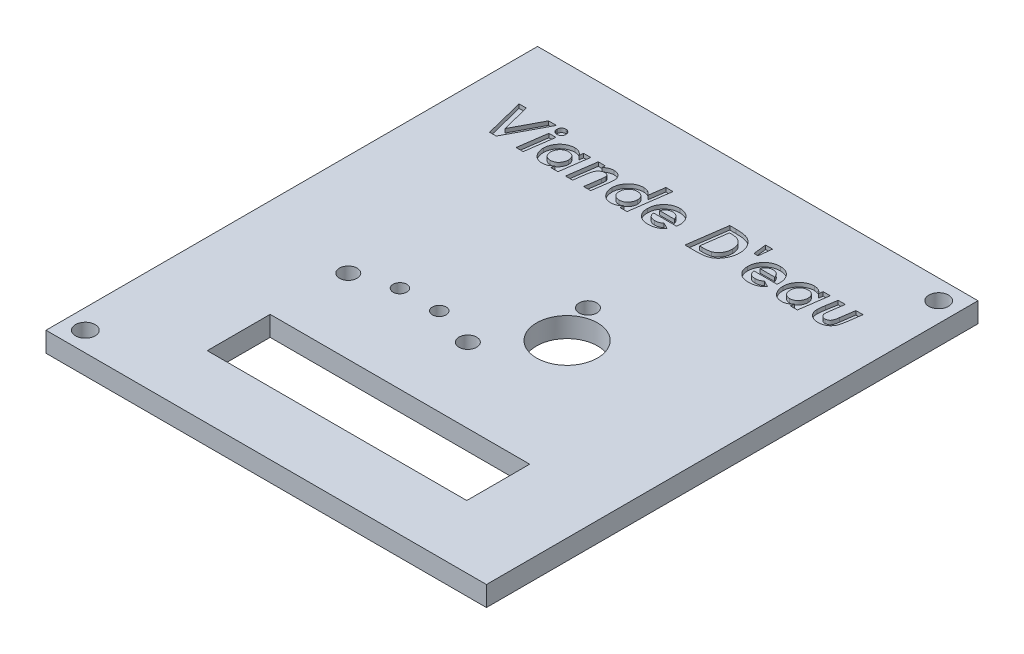
from build123d import *

# Parameters (mm, degrees)
SKETCH1_W           = 112
SKETCH1_H           = 125
BOSS_EXTRUDE1_DEPTH = 5.08
CUT_EXTRUDE1_REACH  = 86.072
SKETCH5_W           = 66
SKETCH5_H           = 16
SKETCH5_R           = 7.75
SKETCH5_R_2         = 2.25
SKETCH5_R_3         = 1.75
SKETCH7_R           = 2.5
CUT_EXTRUDE3_DEPTH  = 4
CUT_EXTRUDE4_DEPTH  = 1


with BuildPart() as part:
    # Sketch1 → Boss-Extrude1 (new body)
    with BuildSketch(Plane(origin=(0, 0, 0), x_dir=(1, 0, 0), z_dir=(0, 1, 0))):
        Rectangle(SKETCH1_W, SKETCH1_H)
    extrude(amount=BOSS_EXTRUDE1_DEPTH)

    # Sketch5 → Cut-Extrude1 (cut, up to next)
    with BuildSketch(Plane(origin=(0, 5.08, 0), x_dir=(1, 0, 0), z_dir=(0, 1, 0)), mode=Mode.PRIVATE) as cut_extrude1_sk1:
        with Locations((2, -38.5)):
            Rectangle(SKETCH5_W, SKETCH5_H)
    cut_extrude1_tool1 = extrude(cut_extrude1_sk1.sketch, amount=-CUT_EXTRUDE1_REACH, mode=Mode.PRIVATE) & part.part
    # Sketch5 → Cut-Extrude1 (cut, up to next)
    with BuildSketch(Plane(origin=(0, 5.08, 0), x_dir=(1, 0, 0), z_dir=(0, 1, 0)), mode=Mode.PRIVATE) as cut_extrude1_sk2:
        with Locations((12.5, 1.5)):
            Circle(SKETCH5_R)
    cut_extrude1_tool2 = extrude(cut_extrude1_sk2.sketch, amount=-CUT_EXTRUDE1_REACH, mode=Mode.PRIVATE) & part.part
    # Sketch5 → Cut-Extrude1 (cut, up to next)
    with BuildSketch(Plane(origin=(0, 5.08, 0), x_dir=(1, 0, 0), z_dir=(0, 1, 0)), mode=Mode.PRIVATE) as cut_extrude1_sk3:
        with Locations((-30.13, -11.51)):
            Circle(SKETCH5_R_2)
    cut_extrude1_tool3 = extrude(cut_extrude1_sk3.sketch, amount=-CUT_EXTRUDE1_REACH, mode=Mode.PRIVATE) & part.part
    # Sketch5 → Cut-Extrude1 (cut, up to next)
    with BuildSketch(Plane(origin=(0, 5.08, 0), x_dir=(1, 0, 0), z_dir=(0, 1, 0)), mode=Mode.PRIVATE) as cut_extrude1_sk4:
        with Locations((-20.25, -8.2495)):
            Circle(SKETCH5_R_3)
    cut_extrude1_tool4 = extrude(cut_extrude1_sk4.sketch, amount=-CUT_EXTRUDE1_REACH, mode=Mode.PRIVATE) & part.part
    # Sketch5 → Cut-Extrude1 (cut, up to next)
    with BuildSketch(Plane(origin=(0, 5.08, 0), x_dir=(1, 0, 0), z_dir=(0, 1, 0)), mode=Mode.PRIVATE) as cut_extrude1_sk5:
        with Locations((-10.25, -8.2495)):
            Circle(SKETCH5_R_3)
    cut_extrude1_tool5 = extrude(cut_extrude1_sk5.sketch, amount=-CUT_EXTRUDE1_REACH, mode=Mode.PRIVATE) & part.part
    # Sketch5 → Cut-Extrude1 (cut, up to next)
    with BuildSketch(Plane(origin=(0, 5.08, 0), x_dir=(1, 0, 0), z_dir=(0, 1, 0)), mode=Mode.PRIVATE) as cut_extrude1_sk6:
        with Locations((0.2695, -11.51)):
            Circle(SKETCH5_R_2)
    cut_extrude1_tool6 = extrude(cut_extrude1_sk6.sketch, amount=-CUT_EXTRUDE1_REACH, mode=Mode.PRIVATE) & part.part
    # Sketch5 → Cut-Extrude1 (cut, up to next)
    with BuildSketch(Plane(origin=(0, 5.08, 0), x_dir=(1, 0, 0), z_dir=(0, 1, 0)), mode=Mode.PRIVATE) as cut_extrude1_sk7:
        with Locations((8.001, 11.311)):
            Circle(SKETCH5_R_2)
    cut_extrude1_tool7 = extrude(cut_extrude1_sk7.sketch, amount=-CUT_EXTRUDE1_REACH, mode=Mode.PRIVATE) & part.part
    add(cut_extrude1_tool1.solids().sort_by_distance((2, 5.08, 38.5))[0], mode=Mode.SUBTRACT)
    add(cut_extrude1_tool2.solids().sort_by_distance((12.5, 5.08, -1.5))[0], mode=Mode.SUBTRACT)
    add(cut_extrude1_tool3.solids().sort_by_distance((-30.13, 5.08, 11.51))[0], mode=Mode.SUBTRACT)
    add(cut_extrude1_tool4.solids().sort_by_distance((-20.25, 5.08, 8.2495))[0], mode=Mode.SUBTRACT)
    add(cut_extrude1_tool5.solids().sort_by_distance((-10.25, 5.08, 8.2495))[0], mode=Mode.SUBTRACT)
    add(cut_extrude1_tool6.solids().sort_by_distance((0.2695, 5.08, 11.51))[0], mode=Mode.SUBTRACT)
    add(cut_extrude1_tool7.solids().sort_by_distance((8.001, 5.08, -11.311))[0], mode=Mode.SUBTRACT)

    # Sketch7 → Cut-Extrude3 (cut)
    with BuildSketch(Plane(origin=(0, 5.08, 0), x_dir=(1, 0, 0), z_dir=(0, 1, 0))):
        with Locations((-51, -57.5)):
            Circle(SKETCH7_R)
        with Locations((51, 57.5)):
            Circle(SKETCH7_R)
    extrude(amount=-CUT_EXTRUDE3_DEPTH, mode=Mode.SUBTRACT)

    # Sketch8 → Cut-Extrude4 (cut)
    # profile 1 of 12: a face of its own
    with BuildSketch(Plane(origin=(0, 5.08, 0), x_dir=(1, 0, 0), z_dir=(0, 1, 0))):
        Polygon((-45.701121795, 47.5), (-43.854166667, 47.5), (-42.051282051, 40.280448718), (-38.219150641, 47.5), (-36.203926282, 47.5), (-41.514423077, 37.5), (-43.203125, 37.5), align=None)
    # profile 2 of 12: a face of its own
    with BuildSketch(Plane(origin=(0, 5.08, 0), x_dir=(1, 0, 0), z_dir=(0, 1, 0))):
        with BuildLine():
            add(Edge.make_bspline(
                [(-34.166666667, 47.884615385), (-34.090168141, 47.880154588), (-33.939902581, 47.871392274), (-33.721996686, 47.808443635), (-33.525282026, 47.695851355), (-33.348226491, 47.549209407), (-33.201584542, 47.372153871), (-33.088992262, 47.175439211), (-33.026043624, 46.957533316), (-33.017281309, 46.807267757), (-33.012820513, 46.730769231)],
                knots=[0, 0, 0, 0, 1.014134371, 1.992057583, 2.975098753, 4, 5.024901247, 6.007942417, 6.985865629, 8, 8, 8, 8], degree=3))
            add(Edge.make_bspline(
                [(-33.012820513, 46.730769231), (-33.017250894, 46.65425342), (-33.025953463, 46.503953908), (-33.089503717, 46.285729419), (-33.200892841, 46.087630522), (-33.348398016, 45.910535017), (-33.524676948, 45.76327428), (-33.722610507, 45.653540087), (-33.939824205, 45.5900065), (-34.090141701, 45.58133675), (-34.166666667, 45.576923077)],
                knots=[0, 0, 0, 0, 1.013694729, 1.991193998, 2.981551723, 4.006008661, 5.030465598, 6.008806002, 6.986305271, 8, 8, 8, 8], degree=3))
            add(Edge.make_bspline(
                [(-34.166666667, 45.576923077), (-34.243208518, 45.581306562), (-34.39355918, 45.589917014), (-34.611099043, 45.654050805), (-34.810403902, 45.762583185), (-34.986731658, 45.910704239), (-35.134852712, 46.087031995), (-35.243385093, 46.286336855), (-35.307518884, 46.503876717), (-35.316129335, 46.65422738), (-35.320512821, 46.730769231)],
                knots=[0, 0, 0, 0, 1.01324697, 1.990314468, 2.975995575, 4, 5.024004425, 6.009685532, 6.98675303, 8, 8, 8, 8], degree=3))
            add(Edge.make_bspline(
                [(-35.320512821, 46.730769231), (-35.316099147, 46.807294197), (-35.307429397, 46.957611693), (-35.24389581, 47.174825391), (-35.134161618, 47.372758949), (-34.98690088, 47.549037882), (-34.809805376, 47.696543056), (-34.611706479, 47.80793218), (-34.39348199, 47.871482435), (-34.243182478, 47.880185004), (-34.166666667, 47.884615385)],
                knots=[0, 0, 0, 0, 1.013694729, 1.991193998, 2.969534402, 3.993991339, 5.018448277, 6.008806002, 6.986305271, 8, 8, 8, 8], degree=3))
        make_face()
    # profile 3 of 12: a face of its own
    with BuildSketch(Plane(origin=(0, 5.08, 0), x_dir=(1, 0, 0), z_dir=(0, 1, 0))):
        Polygon((-35.436698718, 44.807692308), (-33.625801282, 44.807692308), (-34.663461538, 37.5), (-36.474358974, 37.5), align=None)
    # profile 4 of 12: a face of its own
    with BuildSketch(Plane(origin=(0, 5.08, 0), x_dir=(1, 0, 0), z_dir=(0, 1, 0))):
        with BuildLine():
            Line((-26.590544872, 44.807692308), (-24.779647436, 44.807692308))
            Line((-24.779647436, 44.807692308), (-25.817307692, 37.5))
            Line((-25.817307692, 37.5), (-27.628205128, 37.5))
            Line((-27.628205128, 37.5), (-27.502003205, 38.393429487))
            add(Edge.make_bspline(
                [(-27.502003205, 38.393429487), (-27.596165009, 38.30380025), (-27.775714867, 38.132893192), (-28.0538057, 37.911169477), (-28.321500692, 37.730846121), (-28.585417776, 37.592540437), (-28.852806016, 37.49219743), (-29.130355838, 37.422696681), (-29.423710854, 37.379229714), (-29.624576983, 37.374314815), (-29.727564103, 37.371794872)],
                knots=[0, 0, 0, 0, 1.236324186, 2.357450916, 3.379388742, 4.30284698, 5.185433758, 6.089881904, 7.020653398, 8, 8, 8, 8], degree=3))
            add(Edge.make_bspline(
                [(-29.727564103, 37.371794872), (-29.845280738, 37.374537242), (-30.075822558, 37.37990803), (-30.41211944, 37.431881511), (-30.730039852, 37.513166924), (-31.029733509, 37.627863127), (-31.309581065, 37.777574259), (-31.572261767, 37.959060008), (-31.815400222, 38.174554488), (-32.035661884, 38.421207259), (-32.234304226, 38.68705184), (-32.407083008, 38.967971852), (-32.557110056, 39.257394635), (-32.673882925, 39.560607634), (-32.770277785, 39.871940162), (-32.834808102, 40.195544472), (-32.876434841, 40.529097145), (-32.881867435, 40.755081928), (-32.884615385, 40.869391026)],
                knots=[0, 0, 0, 0, 1.072254913, 2.099954687, 3.093402483, 4.05863531, 5.017013142, 5.979305845, 6.962352722, 7.970695896, 8.988290287, 9.983079422, 10.973839091, 11.95483031, 12.940586347, 13.940815436, 14.958409826, 16, 16, 16, 16], degree=3))
            add(Edge.make_bspline(
                [(-32.884615385, 40.869391026), (-32.883236568, 40.9575963), (-32.88049368, 41.133063612), (-32.853403031, 41.39479328), (-32.809262173, 41.652958862), (-32.748638316, 41.908417049), (-32.673071409, 42.161097798), (-32.578607589, 42.410092993), (-32.465295672, 42.654901272), (-32.337927797, 42.895815676), (-32.197340778, 43.129930558), (-32.039633622, 43.349667728), (-31.874083821, 43.559043029), (-31.69538113, 43.75395118), (-31.503975925, 43.933755895), (-31.303813837, 44.104126994), (-31.088449555, 44.256810443), (-30.865466716, 44.39978071), (-30.633570088, 44.524268592), (-30.399044252, 44.636138778), (-30.160077674, 44.727336176), (-29.919683931, 44.804535342), (-29.675767518, 44.862508288), (-29.42951941, 44.904179452), (-29.180650166, 44.931834347), (-29.013827951, 44.934541684), (-28.930288462, 44.935897436)],
                knots=[0, 0, 0, 0, 1.010861959, 2.01091412, 3.012605424, 4.011485121, 5.018863341, 6.033918867, 7.061452407, 8.109228878, 9.15680961, 10.18900835, 11.207521355, 12.215190347, 13.216881651, 14.216552911, 15.225616441, 16.240671966, 17.251099115, 18.240697123, 19.217272556, 20.180771028, 21.133199006, 22.08832996, 23.042693801, 24, 24, 24, 24], degree=3))
            add(Edge.make_bspline(
                [(-28.930288462, 44.935897436), (-28.819191581, 44.932732258), (-28.600203685, 44.926493238), (-28.279463882, 44.86800718), (-27.972201152, 44.775504956), (-27.679176072, 44.647228185), (-27.403989777, 44.4837752), (-27.154678182, 44.282434949), (-26.925608021, 44.051652657), (-26.800396424, 43.872881454), (-26.736778846, 43.782051282)],
                knots=[0, 0, 0, 0, 1.030509072, 2.031281277, 3.015697838, 4.003854478, 4.993584726, 5.977161716, 6.972235198, 8, 8, 8, 8], degree=3))
            Line((-26.736778846, 43.782051282), (-26.590544872, 44.807692308))
        make_face()
        with BuildLine():
            add(Edge.make_bspline(
                [(-29.324919872, 39.038461538), (-29.220494939, 39.041689162), (-29.016846835, 39.047983632), (-28.722629865, 39.103742438), (-28.448460591, 39.191548199), (-28.194753294, 39.317066724), (-27.960635481, 39.482149636), (-27.748124673, 39.68818553), (-27.556182532, 39.935002168), (-27.387852535, 40.215163443), (-27.247174137, 40.516474437), (-27.144101346, 40.827544421), (-27.078369053, 41.14240276), (-27.070989122, 41.354522178), (-27.067307692, 41.460336538)],
                knots=[0, 0, 0, 0, 1.017901168, 1.985097214, 2.910041334, 3.818973104, 4.735274743, 5.693545178, 6.695670165, 7.777101795, 8.875856117, 9.932619244, 10.968700869, 12, 12, 12, 12], degree=3))
            add(Edge.make_bspline(
                [(-27.067307692, 41.460336538), (-27.068991792, 41.526496479), (-27.072301419, 41.6565153), (-27.093935568, 41.846380913), (-27.131967002, 42.026240081), (-27.186535549, 42.19598169), (-27.256238672, 42.355788287), (-27.341592957, 42.506128365), (-27.44137962, 42.64594925), (-27.556076659, 42.775131514), (-27.684250922, 42.889581627), (-27.820151248, 42.994506579), (-27.970095537, 43.076898754), (-28.126815553, 43.148795928), (-28.294593943, 43.20182968), (-28.471147359, 43.243151159), (-28.658681953, 43.264153913), (-28.786683047, 43.267512596), (-28.852163462, 43.269230769)],
                knots=[0, 0, 0, 0, 1.109141645, 2.179707075, 3.198451464, 4.18615572, 5.163657463, 6.116161664, 7.079133258, 8.038519567, 9.005387219, 9.956904198, 10.909408399, 11.866440704, 12.843493655, 13.853714903, 14.902043453, 16, 16, 16, 16], degree=3))
            add(Edge.make_bspline(
                [(-28.852163462, 43.269230769), (-28.928415464, 43.267566333), (-29.078946805, 43.264280521), (-29.300150806, 43.230344404), (-29.513502676, 43.179673616), (-29.716936735, 43.103847069), (-29.912575584, 43.01038925), (-30.097377173, 42.892311546), (-30.274934462, 42.755491926), (-30.441477668, 42.598631444), (-30.593385826, 42.425069972), (-30.726337921, 42.237833532), (-30.839478702, 42.037989804), (-30.931669512, 41.825851283), (-31.001469235, 41.600508852), (-31.053989185, 41.364874349), (-31.084238345, 41.115904953), (-31.08787896, 40.946261872), (-31.08974359, 40.859375)],
                knots=[0, 0, 0, 0, 0.994897251, 1.964056203, 2.915642991, 3.853470011, 4.79324038, 5.741466074, 6.711095529, 7.716481674, 8.723680824, 9.71796663, 10.70964959, 11.717112863, 12.731868792, 13.785363818, 14.865719672, 16, 16, 16, 16], degree=3))
            add(Edge.make_bspline(
                [(-31.08974359, 40.859375), (-31.088029432, 40.792557497), (-31.084677254, 40.66189032), (-31.063597899, 40.470412262), (-31.022547959, 40.28973594), (-30.968644325, 40.118684656), (-30.90064345, 39.957093689), (-30.815946531, 39.805950891), (-30.715108919, 39.66497405), (-30.599582859, 39.535309025), (-30.470940934, 39.419876798), (-30.334614958, 39.316156782), (-30.187679412, 39.230280662), (-30.032139981, 39.159268084), (-29.867427054, 39.105306177), (-29.694124489, 39.068073327), (-29.512632706, 39.042607541), (-29.388445688, 39.039864629), (-29.324919872, 39.038461538)],
                knots=[0, 0, 0, 0, 1.124431694, 2.198919568, 3.234766021, 4.236791382, 5.213425507, 6.179206721, 7.145706547, 8.12447102, 9.094881178, 10.04988442, 11.001776355, 11.952075609, 12.922030374, 13.911569148, 14.931697721, 16, 16, 16, 16], degree=3))
        make_face(mode=Mode.SUBTRACT)
    # profile 5 of 12: a face of its own
    with BuildSketch(Plane(origin=(0, 5.08, 0), x_dir=(1, 0, 0), z_dir=(0, 1, 0))):
        with BuildLine():
            Line((-22.872596154, 44.807692308), (-21.061698718, 44.807692308))
            Line((-21.061698718, 44.807692308), (-21.17588141, 44.000400641))
            add(Edge.make_bspline(
                [(-21.17588141, 44.000400641), (-21.088807224, 44.074537439), (-20.918597248, 44.2194578), (-20.650791447, 44.409409918), (-20.382763712, 44.574477176), (-20.109020923, 44.703596167), (-19.834186255, 44.808230119), (-19.556322565, 44.881747101), (-19.275080076, 44.928365647), (-19.086717333, 44.933384208), (-18.992387821, 44.935897436)],
                knots=[0, 0, 0, 0, 1.129074261, 2.207080079, 3.239806547, 4.233987332, 5.191979582, 6.140686111, 7.068880775, 8, 8, 8, 8], degree=3))
            add(Edge.make_bspline(
                [(-18.992387821, 44.935897436), (-18.913539959, 44.933655668), (-18.758755356, 44.929254901), (-18.531843723, 44.904109201), (-18.316782141, 44.857417271), (-18.112219218, 44.79382962), (-17.920126055, 44.708116834), (-17.73590606, 44.60909327), (-17.565389279, 44.486875693), (-17.405660736, 44.350170529), (-17.262808211, 44.197957198), (-17.134731094, 44.037721439), (-17.02844261, 43.865715005), (-16.93934591, 43.684985249), (-16.871075476, 43.493375881), (-16.82328867, 43.292537314), (-16.794834635, 43.082411344), (-16.790878727, 42.939457897), (-16.788862179, 42.866586538)],
                knots=[0, 0, 0, 0, 1.118022855, 2.194767494, 3.230795032, 4.233728951, 5.225657328, 6.208555818, 7.193457995, 8.193528683, 9.184553253, 10.148487881, 11.096723343, 12.045053303, 13.000209424, 13.973718189, 14.967090947, 16, 16, 16, 16], degree=3))
            add(Edge.make_bspline(
                [(-16.788862179, 42.866586538), (-16.791023067, 42.787773613), (-16.795807547, 42.613271821), (-16.816132661, 42.32507586), (-16.856384753, 41.986184279), (-16.888092814, 41.742751195), (-16.905048077, 41.612580128)],
                knots=[0, 0, 0, 0, 0.750743129, 1.6622403, 2.749928862, 4, 4, 4, 4], degree=3))
            Line((-16.905048077, 41.612580128), (-17.483974359, 37.5))
            Line((-17.483974359, 37.5), (-19.294871795, 37.5))
            Line((-19.294871795, 37.5), (-18.727964744, 41.522435897))
            add(Edge.make_bspline(
                [(-18.727964744, 41.522435897), (-18.715599095, 41.613869479), (-18.692520649, 41.7845152), (-18.665498261, 42.022163247), (-18.651220057, 42.223393291), (-18.647505357, 42.345071267), (-18.645833333, 42.399839744)],
                knots=[0, 0, 0, 0, 1.255630561, 2.343427635, 3.254360171, 4, 4, 4, 4], degree=3))
            add(Edge.make_bspline(
                [(-18.645833333, 42.399839744), (-18.648682752, 42.465566045), (-18.654147544, 42.591619997), (-18.701905772, 42.769616513), (-18.786362845, 42.922484556), (-18.903101454, 43.048703807), (-19.049174122, 43.148277804), (-19.222557594, 43.220969183), (-19.424510843, 43.262228843), (-19.567780818, 43.266811211), (-19.643429487, 43.269230769)],
                knots=[0, 0, 0, 0, 1.048265012, 2.010427263, 2.912347805, 3.810226671, 4.72992967, 5.714049657, 6.792984344, 8, 8, 8, 8], degree=3))
            add(Edge.make_bspline(
                [(-19.643429487, 43.269230769), (-19.72116936, 43.264906136), (-19.878586244, 43.256149106), (-20.114749236, 43.198316662), (-20.347523926, 43.096783475), (-20.578182309, 42.964409875), (-20.796679458, 42.797457691), (-20.989260995, 42.594762458), (-21.15744301, 42.364437207), (-21.273846502, 42.145952565), (-21.354939254, 41.945786584), (-21.415068056, 41.763781865), (-21.471628933, 41.5513111), (-21.529925588, 41.309687721), (-21.585360257, 41.037538905), (-21.641325037, 40.736436802), (-21.695646915, 40.404525028), (-21.727928593, 40.173016903), (-21.744791667, 40.052083333)],
                knots=[0, 0, 0, 0, 0.882065441, 1.786110384, 2.740104157, 3.754965612, 4.797500545, 5.847687264, 6.91599857, 8.024311006, 8.646136181, 9.364850473, 10.197408591, 11.140054438, 12.184569392, 13.348033438, 14.614684545, 16, 16, 16, 16], degree=3))
            Line((-21.744791667, 40.052083333), (-22.099358974, 37.5))
            Line((-22.099358974, 37.5), (-23.91025641, 37.5))
            Line((-23.91025641, 37.5), (-22.872596154, 44.807692308))
        make_face()
    # profile 6 of 12: a face of its own
    with BuildSketch(Plane(origin=(0, 5.08, 0), x_dir=(1, 0, 0), z_dir=(0, 1, 0))):
        with BuildLine():
            Line((-8.625801282, 47.756410256), (-6.816907051, 47.756410256))
            Line((-6.816907051, 47.756410256), (-8.255208333, 37.5))
            Line((-8.255208333, 37.5), (-10.064102564, 37.5))
            Line((-10.064102564, 37.5), (-9.939903846, 38.377403846))
            add(Edge.make_bspline(
                [(-9.939903846, 38.377403846), (-10.037041394, 38.290089598), (-10.222695667, 38.123210119), (-10.50497816, 37.90236628), (-10.780098531, 37.726603976), (-11.049938862, 37.590837104), (-11.322513271, 37.489506877), (-11.607353203, 37.423181768), (-11.907018949, 37.379184032), (-12.112549946, 37.374293343), (-12.217548077, 37.371794872)],
                knots=[0, 0, 0, 0, 1.224191978, 2.339738612, 3.35557837, 4.279346016, 5.166550601, 6.074424882, 7.016295399, 8, 8, 8, 8], degree=3))
            add(Edge.make_bspline(
                [(-12.217548077, 37.371794872), (-12.337926604, 37.374558334), (-12.573766458, 37.379972376), (-12.917451609, 37.431598333), (-13.242495081, 37.513526622), (-13.549564589, 37.627800214), (-13.837009965, 37.777032118), (-14.106069791, 37.958276479), (-14.353226013, 38.175167353), (-14.579978549, 38.420233658), (-14.781655165, 38.687777871), (-14.96193294, 38.966604908), (-15.112361038, 39.257957418), (-15.234617037, 39.559998325), (-15.332032524, 39.871947805), (-15.399508122, 40.195282115), (-15.440378546, 40.529130036), (-15.445916636, 40.755092976), (-15.448717949, 40.869391026)],
                knots=[0, 0, 0, 0, 1.084756537, 2.125203127, 3.125436952, 4.102778343, 5.072150728, 6.038977154, 7.020481913, 8.030147435, 9.044022342, 10.037711967, 11.020545278, 11.995435886, 12.972332138, 13.96300789, 14.969635358, 16, 16, 16, 16], degree=3))
            add(Edge.make_bspline(
                [(-15.448717949, 40.869391026), (-15.447350493, 40.957598719), (-15.444630204, 41.133070845), (-15.417371358, 41.394764688), (-15.373842717, 41.653220059), (-15.310731295, 41.908507581), (-15.232610002, 42.160688995), (-15.139256257, 42.410642036), (-15.02299301, 42.654752896), (-14.894556953, 42.896626545), (-14.748691037, 43.128623473), (-14.592167426, 43.351039683), (-14.421930623, 43.559044207), (-14.239452488, 43.753358859), (-14.045943252, 43.934481187), (-13.841698359, 44.104072302), (-13.622483225, 44.2568845), (-13.39541477, 44.399738002), (-13.159168558, 44.52486899), (-12.919463385, 44.635669785), (-12.676104031, 44.727432252), (-12.431658051, 44.804532364), (-12.183757028, 44.862516159), (-11.93350818, 44.904181055), (-11.679975707, 44.931907311), (-11.509821436, 44.934562552), (-11.424278846, 44.935897436)],
                knots=[0, 0, 0, 0, 1.001967791, 1.993220895, 2.986098719, 3.977961405, 4.97869321, 5.984817669, 7.006498751, 8.048625242, 9.094941425, 10.118058263, 11.137144237, 12.14626801, 13.144667405, 14.147209555, 15.159750235, 16.178723228, 17.193620539, 18.195157345, 19.177309233, 20.146807454, 21.105618391, 22.067306845, 23.028366579, 24, 24, 24, 24], degree=3))
            add(Edge.make_bspline(
                [(-11.424278846, 44.935897436), (-11.311168059, 44.932044965), (-11.088100298, 44.92444744), (-10.761190764, 44.864178897), (-10.447679683, 44.768492535), (-10.150873625, 44.630829284), (-9.871150316, 44.458896128), (-9.615240864, 44.249336822), (-9.385690388, 44.002234352), (-9.257832654, 43.815211824), (-9.192708333, 43.719951923)],
                knots=[0, 0, 0, 0, 1.021752344, 2.015015653, 2.994318812, 3.977315891, 4.96380846, 5.954501398, 6.958125541, 8, 8, 8, 8], degree=3))
            Line((-9.192708333, 43.719951923), (-8.625801282, 47.756410256))
        make_face()
        with BuildLine():
            add(Edge.make_bspline(
                [(-11.834935897, 39.038461538), (-11.727846275, 39.041692581), (-11.518907673, 39.047996548), (-11.216759182, 39.103767765), (-10.934630911, 39.191476689), (-10.673054623, 39.316984869), (-10.430958636, 39.481240673), (-10.212286924, 39.68798175), (-10.014023669, 39.934587293), (-9.840180915, 40.215014305), (-9.692400078, 40.515430222), (-9.588443256, 40.827551692), (-9.519708216, 41.142153745), (-9.512705717, 41.354483346), (-9.509214744, 41.460336538)],
                knots=[0, 0, 0, 0, 1.029364739, 2.008355467, 2.944869541, 3.864220442, 4.788874237, 5.747766117, 6.747937481, 7.824404024, 8.916094465, 9.960164733, 10.983075963, 12, 12, 12, 12], degree=3))
            add(Edge.make_bspline(
                [(-9.509214744, 41.460336538), (-9.510732019, 41.526509124), (-9.513715639, 41.656633057), (-9.537745146, 41.846541308), (-9.578484548, 42.025914346), (-9.631884173, 42.196496723), (-9.704442823, 42.355757063), (-9.791354938, 42.506813392), (-9.89553013, 42.646009091), (-10.014098212, 42.775245054), (-10.146266677, 42.889663643), (-10.28621809, 42.994593339), (-10.440132016, 43.076888973), (-10.601386935, 43.149218754), (-10.774657657, 43.201769854), (-10.956532728, 43.242956441), (-11.149336001, 43.264258188), (-11.280671708, 43.267542938), (-11.348157051, 43.269230769)],
                knots=[0, 0, 0, 0, 1.092929283, 2.14917182, 3.155385987, 4.128652935, 5.096340581, 6.040415546, 7.002301806, 7.962478832, 8.931674171, 9.887023602, 10.844853392, 11.808066958, 12.802359889, 13.83011003, 14.885026967, 16, 16, 16, 16], degree=3))
            add(Edge.make_bspline(
                [(-11.348157051, 43.269230769), (-11.427078469, 43.267593637), (-11.582262591, 43.264374524), (-11.810113967, 43.230342353), (-12.029431944, 43.179688994), (-12.238863571, 43.103884119), (-12.440505263, 43.010502904), (-12.631229328, 42.892331861), (-12.814860199, 42.756345704), (-12.985334724, 42.597994313), (-13.143384246, 42.425841266), (-13.280393016, 42.238394754), (-13.395688474, 42.038103392), (-13.488988992, 41.825509296), (-13.5648781, 41.601316948), (-13.615079367, 41.364599561), (-13.649137462, 41.11610618), (-13.652251836, 40.946301733), (-13.653846154, 40.859375)],
                knots=[0, 0, 0, 0, 1.015017545, 1.99584108, 2.958882485, 3.907551637, 4.857154596, 5.813732046, 6.790026937, 7.79362874, 8.803576363, 9.793693459, 10.775457832, 11.771969563, 12.777519716, 13.815952619, 14.881936806, 16, 16, 16, 16], degree=3))
            add(Edge.make_bspline(
                [(-13.653846154, 40.859375), (-13.652385986, 40.792523704), (-13.649528753, 40.661710169), (-13.624870534, 40.470626313), (-13.585359893, 40.289324751), (-13.528395359, 40.118725257), (-13.459179712, 39.956347823), (-13.369526644, 39.806544323), (-13.267332764, 39.664186198), (-13.147416212, 39.535302307), (-13.014983369, 39.419744279), (-12.874535338, 39.316160869), (-12.723234158, 39.229681609), (-12.562562334, 39.159733342), (-12.393449505, 39.105239664), (-12.215480446, 39.067895923), (-12.028630803, 39.042643307), (-11.900460787, 39.039876186), (-11.834935897, 39.038461538)],
                knots=[0, 0, 0, 0, 1.107979885, 2.168077127, 3.188767881, 4.179540202, 5.146268969, 6.108932095, 7.067768028, 8.04709314, 9.01982551, 9.978661443, 10.935770145, 11.902498912, 12.87931775, 13.876010336, 14.914143953, 16, 16, 16, 16], degree=3))
        make_face(mode=Mode.SUBTRACT)
    # profile 7 of 12: a face of its own
    with BuildSketch(Plane(origin=(0, 5.08, 0), x_dir=(1, 0, 0), z_dir=(0, 1, 0))):
        with BuildLine():
            Line((-0.977564103, 39.661458333), (0.590945513, 38.856169872))
            add(Edge.make_bspline(
                [(0.590945513, 38.856169872), (0.498284259, 38.745303126), (0.312034678, 38.522460412), (-0.02278649, 38.233641197), (-0.397389088, 37.977623233), (-0.813082133, 37.76112666), (-1.262011527, 37.58576748), (-1.739029186, 37.463711892), (-2.238892319, 37.38371554), (-2.580478905, 37.375816755), (-2.754407051, 37.371794872)],
                knots=[0, 0, 0, 0, 0.914244933, 1.837636877, 2.790537697, 3.784087733, 4.800790172, 5.83726639, 6.89878507, 8, 8, 8, 8], degree=3))
            add(Edge.make_bspline(
                [(-2.754407051, 37.371794872), (-2.890098853, 37.374101173), (-3.154229053, 37.378590491), (-3.539281456, 37.424653598), (-3.903155905, 37.494791739), (-4.24400304, 37.597936229), (-4.564727145, 37.725698771), (-4.861371466, 37.886408014), (-5.135866565, 38.076823883), (-5.388237585, 38.291770269), (-5.61248958, 38.533519257), (-5.810205866, 38.793654748), (-5.975003605, 39.075489471), (-6.112509398, 39.374207028), (-6.215800107, 39.694021775), (-6.292674575, 40.030994305), (-6.336377289, 40.388148264), (-6.342843054, 40.632229725), (-6.346153846, 40.757211538)],
                knots=[0, 0, 0, 0, 1.167516698, 2.272623801, 3.333371772, 4.353538571, 5.333382306, 6.300396664, 7.250661637, 8.204535574, 9.148031545, 10.083792083, 11.011414416, 11.952824574, 12.908912643, 13.898953575, 14.92416002, 16, 16, 16, 16], degree=3))
            add(Edge.make_bspline(
                [(-6.346153846, 40.757211538), (-6.343191024, 40.900992049), (-6.33736392, 41.183771011), (-6.276473484, 41.598140728), (-6.18267746, 41.99610608), (-6.051212263, 42.377442243), (-5.877820356, 42.740444396), (-5.672237217, 43.089320878), (-5.423508761, 43.417817326), (-5.142429221, 43.726772767), (-4.835191472, 44.008224156), (-4.509426038, 44.256999616), (-4.166231431, 44.466730755), (-3.808143829, 44.639271351), (-3.433473582, 44.773270181), (-3.043083159, 44.865840688), (-2.637478087, 44.926992976), (-2.361336658, 44.932904856), (-2.221554487, 44.935897436)],
                knots=[0, 0, 0, 0, 1.05529311, 2.075487762, 3.068699193, 4.055083011, 5.031283693, 6.018666653, 7.023995929, 8.051577733, 9.082465902, 10.079966066, 11.057287041, 12.031169187, 12.994424047, 13.973330935, 14.974104677, 16, 16, 16, 16], degree=3))
            add(Edge.make_bspline(
                [(-2.221554487, 44.935897436), (-2.136725939, 44.934014712), (-1.969510387, 44.930303454), (-1.721738688, 44.911154527), (-1.481975735, 44.8737951), (-1.248511714, 44.827263925), (-1.023276864, 44.762153953), (-0.805037826, 44.683349772), (-0.591541994, 44.594637872), (-0.388074932, 44.486922354), (-0.190959945, 44.370466365), (-0.006541567, 44.23612726), (0.169910088, 44.093002696), (0.335317045, 43.936170907), (0.487137695, 43.764771273), (0.630478325, 43.581993196), (0.761935457, 43.385224477), (0.884160561, 43.178422296), (0.991156932, 42.961351747), (1.088501226, 42.741127244), (1.165571005, 42.513833281), (1.233549537, 42.28386781), (1.281454653, 42.046939481), (1.32189723, 41.80675865), (1.340305669, 41.561449835), (1.344195745, 41.396919989), (1.346153846, 41.314102564)],
                knots=[0, 0, 0, 0, 1.072343926, 2.113823519, 3.137889586, 4.13760148, 5.120645553, 6.097657508, 7.069516392, 8.039614793, 9.005002879, 9.960565349, 10.920144366, 11.87525951, 12.837543921, 13.811635494, 14.808779264, 15.826321551, 16.845367656, 17.865985152, 18.866871901, 19.876579391, 20.894541571, 21.919893521, 22.952961626, 24, 24, 24, 24], degree=3))
            add(Edge.make_bspline(
                [(1.346153846, 41.314102564), (1.345297618, 41.25933122), (1.343520653, 41.145661923), (1.331027644, 40.967815465), (1.308697902, 40.776801863), (1.288480818, 40.644972609), (1.278044872, 40.576923077)],
                knots=[0, 0, 0, 0, 0.886860648, 1.840539587, 2.885298471, 4, 4, 4, 4], degree=3))
            Line((1.278044872, 40.576923077), (-4.551282051, 40.576923077))
            add(Edge.make_bspline(
                [(-4.551282051, 40.576923077), (-4.547456948, 40.519423051), (-4.539995053, 40.407253761), (-4.514804022, 40.243794298), (-4.471968678, 40.090305405), (-4.415462085, 39.945743277), (-4.347265154, 39.808451029), (-4.265352668, 39.679051518), (-4.166188561, 39.561507159), (-4.055432211, 39.45214302), (-3.931977575, 39.354453445), (-3.796363821, 39.270424273), (-3.651001334, 39.196476624), (-3.492293079, 39.140152105), (-3.323813373, 39.093115305), (-3.143922918, 39.062181334), (-2.953231425, 39.041050786), (-2.821911004, 39.039340628), (-2.754407051, 39.038461538)],
                knots=[0, 0, 0, 0, 1.040300458, 2.029386266, 2.980027991, 3.911437883, 4.828060054, 5.744444316, 6.66911896, 7.598419554, 8.551199615, 9.504589747, 10.47513087, 11.489753162, 12.539789264, 13.630032591, 14.781741895, 16, 16, 16, 16], degree=3))
            add(Edge.make_bspline(
                [(-2.754407051, 39.038461538), (-2.672214327, 39.04059688), (-2.50935632, 39.044827881), (-2.268342375, 39.07218517), (-2.034912281, 39.123645166), (-1.808464696, 39.1916054), (-1.588123982, 39.277033367), (-1.37793505, 39.387456161), (-1.171682391, 39.512819577), (-1.042821351, 39.611490057), (-0.977564103, 39.661458333)],
                knots=[0, 0, 0, 0, 1.027214308, 2.035339218, 3.025519259, 4.010199041, 4.987959988, 5.973205312, 6.973599434, 8, 8, 8, 8], degree=3))
        make_face()
        with BuildLine():
            add(Edge.make_bspline(
                [(-0.576923077, 41.858974359), (-0.612543273, 41.969033397), (-0.681130527, 42.180953827), (-0.830742677, 42.468643499), (-1.013373561, 42.714450086), (-1.229247792, 42.916609361), (-1.474231891, 43.074050302), (-1.743657387, 43.187920517), (-2.037712197, 43.258064842), (-2.242524592, 43.265440952), (-2.34775641, 43.269230769)],
                knots=[0, 0, 0, 0, 1.131480038, 2.178682812, 3.159669316, 4.117470342, 5.058967564, 5.99670948, 6.970717055, 8, 8, 8, 8], degree=3))
            add(Edge.make_bspline(
                [(-2.34775641, 43.269230769), (-2.453032715, 43.265533614), (-2.660689391, 43.258241005), (-2.962392693, 43.183936757), (-3.249808151, 43.069481019), (-3.516719256, 42.905749129), (-3.763767521, 42.703850853), (-3.975813035, 42.457211647), (-4.16268784, 42.176543555), (-4.25395719, 41.966806343), (-4.30088141, 41.858974359)],
                knots=[0, 0, 0, 0, 0.983432494, 1.939812791, 2.890131691, 3.868528921, 4.858194814, 5.863362488, 6.901492691, 8, 8, 8, 8], degree=3))
            Line((-4.30088141, 41.858974359), (-0.576923077, 41.858974359))
        make_face(mode=Mode.SUBTRACT)
    # profile 8 of 12: a face of its own
    with BuildSketch(Plane(origin=(0, 5.08, 0), x_dir=(1, 0, 0), z_dir=(0, 1, 0))):
        with BuildLine():
            Line((7.876602564, 47.5), (9.455128205, 47.5))
            add(Edge.make_bspline(
                [(9.455128205, 47.5), (9.634106235, 47.498521799), (9.980214992, 47.495663244), (10.482133416, 47.472093743), (10.947957331, 47.430492785), (11.378539094, 47.372914164), (11.773913708, 47.299454078), (12.134232182, 47.210503172), (12.459853631, 47.105271386), (12.7516854, 46.978832546), (13.020393288, 46.836949968), (13.272209479, 46.675055098), (13.511471105, 46.495169833), (13.739791639, 46.29843238), (13.952542943, 46.080521319), (14.152718994, 45.843733544), (14.341086009, 45.58858236), (14.517008508, 45.317716603), (14.675252399, 45.031326785), (14.813490646, 44.731992587), (14.932176702, 44.422552807), (15.026050674, 44.10130879), (15.100260856, 43.770082033), (15.154207215, 43.427581317), (15.187137931, 43.074235924), (15.190570549, 42.835274193), (15.192307692, 42.714342949)],
                knots=[0, 0, 0, 0, 1.508928034, 2.917973822, 4.235011166, 5.450779055, 6.579221784, 7.623755204, 8.577985451, 9.460610614, 10.301756591, 11.137250569, 11.981705789, 12.823774396, 13.675702816, 14.546470419, 15.435981066, 16.347923198, 17.267651715, 18.192054867, 19.125737078, 20.059147693, 21.011116727, 21.985721956, 22.980635317, 24, 24, 24, 24], degree=3))
            add(Edge.make_bspline(
                [(15.192307692, 42.714342949), (15.189866894, 42.58940158), (15.185015467, 42.34106316), (15.150204371, 41.973056882), (15.093907845, 41.612503198), (15.016309022, 41.259527411), (14.914108756, 40.913988723), (14.786500597, 40.577707715), (14.641201239, 40.247320849), (14.470455719, 39.929622795), (14.286317394, 39.624583734), (14.086954549, 39.339360232), (13.877855628, 39.074260126), (13.653762838, 38.832920294), (13.418980684, 38.611901543), (13.173421984, 38.411208968), (12.91443769, 38.233626464), (12.642319118, 38.07599913), (12.349821524, 37.937825926), (12.032467086, 37.820773345), (11.689280472, 37.720169223), (11.318619071, 37.641630294), (10.922251063, 37.577514726), (10.499046078, 37.531592321), (10.049052283, 37.506452628), (9.740281313, 37.502192868), (9.581330128, 37.5)],
                knots=[0, 0, 0, 0, 1.035326767, 2.057856534, 3.060426681, 4.057975219, 5.050723532, 6.043595218, 7.036960241, 8.039530388, 9.030318104, 9.988216712, 10.921569661, 11.826132526, 12.714780289, 13.59198308, 14.451536877, 15.31430869, 16.195534129, 17.128821459, 18.114698389, 19.15667332, 20.266554844, 21.441073174, 22.682698532, 24, 24, 24, 24], degree=3))
            Line((9.581330128, 37.5), (6.474358974, 37.5))
            Line((6.474358974, 37.5), (7.876602564, 47.5))
        make_face()
        with BuildLine():
            Line((9.453125, 45.833333333), (8.51963141, 39.166666667))
            Line((8.51963141, 39.166666667), (9.166666667, 39.166666667))
            add(Edge.make_bspline(
                [(9.166666667, 39.166666667), (9.286875704, 39.167282348), (9.518009732, 39.16846616), (9.851890139, 39.181718913), (10.160103696, 39.197495911), (10.442490999, 39.226791747), (10.700083863, 39.259390071), (10.931132452, 39.301859828), (11.138294218, 39.347509074), (11.264332893, 39.390612051), (11.32411859, 39.411057692)],
                knots=[0, 0, 0, 0, 1.323091274, 2.54399687, 3.677836413, 4.719289959, 5.668358043, 6.534823038, 7.305002022, 8, 8, 8, 8], degree=3))
            add(Edge.make_bspline(
                [(11.32411859, 39.411057692), (11.400936335, 39.440914151), (11.553541864, 39.500226756), (11.768757796, 39.615601528), (11.977571477, 39.737885101), (12.170851925, 39.881719259), (12.355450447, 40.037854647), (12.523982198, 40.212962018), (12.684629045, 40.400600863), (12.831697403, 40.604385257), (12.966146615, 40.821046614), (13.080643071, 41.052279529), (13.179507951, 41.295011483), (13.258673515, 41.551248409), (13.321399223, 41.818967188), (13.36425235, 42.098962699), (13.39417064, 42.391178842), (13.396334481, 42.590732766), (13.397435897, 42.692307692)],
                knots=[0, 0, 0, 0, 0.952655881, 1.892538673, 2.821337892, 3.750040712, 4.676008024, 5.615700279, 6.558436491, 7.532008524, 8.520486916, 9.505184105, 10.513747313, 11.549809891, 12.604882282, 13.692134403, 14.825273528, 16, 16, 16, 16], degree=3))
            add(Edge.make_bspline(
                [(13.397435897, 42.692307692), (13.396284924, 42.775801395), (13.394035411, 42.938985159), (13.376359503, 43.178587198), (13.343597666, 43.407840624), (13.300718732, 43.626873578), (13.243729203, 43.835494713), (13.175819168, 44.033660422), (13.096705725, 44.222805527), (12.970090539, 44.456113581), (12.789610786, 44.728311281), (12.525967749, 45.016015665), (12.219592957, 45.26179193), (11.934020232, 45.433548645), (11.684798036, 45.551073483), (11.480119986, 45.626327246), (11.260675073, 45.690927045), (11.026083486, 45.741515418), (10.777727505, 45.784979323), (10.513909227, 45.811039448), (10.235329073, 45.830341973), (10.044108292, 45.832318405), (9.945913462, 45.833333333)],
                knots=[0, 0, 0, 0, 0.941373656, 1.839862062, 2.706559874, 3.551131217, 4.354742518, 5.142827075, 5.911946928, 6.663057697, 8.133107042, 9.582556681, 11.0440985, 12.547036792, 13.328439944, 14.147940985, 15.003216405, 15.905576335, 16.852443473, 17.844335315, 18.893032825, 20, 20, 20, 20], degree=3))
            Line((9.945913462, 45.833333333), (9.453125, 45.833333333))
        make_face(mode=Mode.SUBTRACT)
    # profile 9 of 12: a face of its own
    with BuildSketch(Plane(origin=(0, 5.08, 0), x_dir=(1, 0, 0), z_dir=(0, 1, 0))):
        Polygon((18.141025641, 44.423076923), (17.115384615, 44.423076923), (16.730769231, 47.756410256), (18.525641026, 47.756410256), align=None)
    # profile 10 of 12: a face of its own
    with BuildSketch(Plane(origin=(0, 5.08, 0), x_dir=(1, 0, 0), z_dir=(0, 1, 0))):
        with BuildLine():
            Line((24.53525641, 39.661458333), (26.103766026, 38.856169872))
            add(Edge.make_bspline(
                [(26.103766026, 38.856169872), (26.011104772, 38.745303126), (25.82485519, 38.522460412), (25.490034023, 38.233641197), (25.115431425, 37.977623233), (24.69973838, 37.76112666), (24.250808986, 37.58576748), (23.773791326, 37.463711892), (23.273928194, 37.38371554), (22.932341608, 37.375816755), (22.758413462, 37.371794872)],
                knots=[0, 0, 0, 0, 0.914244933, 1.837636877, 2.790537697, 3.784087733, 4.800790172, 5.83726639, 6.89878507, 8, 8, 8, 8], degree=3))
            add(Edge.make_bspline(
                [(22.758413462, 37.371794872), (22.62272166, 37.374101173), (22.35859146, 37.378590491), (21.973539056, 37.424653598), (21.609664607, 37.494791739), (21.268817473, 37.597936229), (20.948093368, 37.725698771), (20.651449047, 37.886408014), (20.376953948, 38.076823883), (20.124582928, 38.291770269), (19.900330933, 38.533519257), (19.702614647, 38.793654748), (19.537816908, 39.075489471), (19.400311114, 39.374207028), (19.297020406, 39.694021775), (19.220145937, 40.030994305), (19.176443224, 40.388148264), (19.169977459, 40.632229725), (19.166666667, 40.757211538)],
                knots=[0, 0, 0, 0, 1.167516698, 2.272623801, 3.333371772, 4.353538571, 5.333382306, 6.300396664, 7.250661637, 8.204535574, 9.148031545, 10.083792083, 11.011414416, 11.952824574, 12.908912643, 13.898953575, 14.92416002, 16, 16, 16, 16], degree=3))
            add(Edge.make_bspline(
                [(19.166666667, 40.757211538), (19.169629489, 40.900992049), (19.175456593, 41.183771011), (19.236347029, 41.598140728), (19.330143053, 41.99610608), (19.46160825, 42.377442243), (19.635000157, 42.740444396), (19.840583295, 43.089320878), (20.089311752, 43.417817326), (20.370391292, 43.726772767), (20.67762904, 44.008224156), (21.003394475, 44.256999616), (21.346589082, 44.466730755), (21.704676684, 44.639271351), (22.079346931, 44.773270181), (22.469737354, 44.865840688), (22.875342426, 44.926992976), (23.151483855, 44.932904856), (23.291266026, 44.935897436)],
                knots=[0, 0, 0, 0, 1.05529311, 2.075487762, 3.068699193, 4.055083011, 5.031283693, 6.018666653, 7.023995929, 8.051577733, 9.082465902, 10.079966066, 11.057287041, 12.031169187, 12.994424047, 13.973330935, 14.974104677, 16, 16, 16, 16], degree=3))
            add(Edge.make_bspline(
                [(23.291266026, 44.935897436), (23.376094574, 44.934014712), (23.543310126, 44.930303454), (23.791081825, 44.911154527), (24.030844778, 44.8737951), (24.264308799, 44.827263925), (24.489543649, 44.762153953), (24.707782687, 44.683349772), (24.921278519, 44.594637872), (25.124745581, 44.486922354), (25.321860568, 44.370466365), (25.506278946, 44.23612726), (25.682730601, 44.093002696), (25.848137558, 43.936170907), (25.999958208, 43.764771273), (26.143298837, 43.581993196), (26.27475597, 43.385224477), (26.396981074, 43.178422296), (26.503977445, 42.961351747), (26.601321738, 42.741127244), (26.678391518, 42.513833281), (26.74637005, 42.28386781), (26.794275165, 42.046939481), (26.834717742, 41.80675865), (26.853126181, 41.561449835), (26.857016258, 41.396919989), (26.858974359, 41.314102564)],
                knots=[0, 0, 0, 0, 1.072343926, 2.113823519, 3.137889586, 4.13760148, 5.120645553, 6.097657508, 7.069516392, 8.039614793, 9.005002879, 9.960565349, 10.920144366, 11.87525951, 12.837543921, 13.811635494, 14.808779264, 15.826321551, 16.845367656, 17.865985152, 18.866871901, 19.876579391, 20.894541571, 21.919893521, 22.952961626, 24, 24, 24, 24], degree=3))
            add(Edge.make_bspline(
                [(26.858974359, 41.314102564), (26.858118131, 41.25933122), (26.856341166, 41.145661923), (26.843848157, 40.967815465), (26.821518414, 40.776801863), (26.801301331, 40.644972609), (26.790865385, 40.576923077)],
                knots=[0, 0, 0, 0, 0.886860648, 1.840539587, 2.885298471, 4, 4, 4, 4], degree=3))
            Line((26.790865385, 40.576923077), (20.961538462, 40.576923077))
            add(Edge.make_bspline(
                [(20.961538462, 40.576923077), (20.965363565, 40.519423051), (20.97282546, 40.407253761), (20.99801649, 40.243794298), (21.040851835, 40.090305405), (21.097358428, 39.945743277), (21.165555359, 39.808451029), (21.247467845, 39.679051518), (21.346631952, 39.561507159), (21.457388302, 39.45214302), (21.580842938, 39.354453445), (21.716456692, 39.270424273), (21.861819179, 39.196476624), (22.020527434, 39.140152105), (22.18900714, 39.093115305), (22.368897594, 39.062181334), (22.559589088, 39.041050786), (22.690909509, 39.039340628), (22.758413462, 39.038461538)],
                knots=[0, 0, 0, 0, 1.040300458, 2.029386266, 2.980027991, 3.911437883, 4.828060054, 5.744444316, 6.66911896, 7.598419554, 8.551199615, 9.504589747, 10.47513087, 11.489753162, 12.539789264, 13.630032591, 14.781741895, 16, 16, 16, 16], degree=3))
            add(Edge.make_bspline(
                [(22.758413462, 39.038461538), (22.840606186, 39.04059688), (23.003464193, 39.044827881), (23.244478138, 39.07218517), (23.477908232, 39.123645166), (23.704355817, 39.1916054), (23.924696531, 39.277033367), (24.134885463, 39.387456161), (24.341138122, 39.512819577), (24.469999162, 39.611490057), (24.53525641, 39.661458333)],
                knots=[0, 0, 0, 0, 1.027214308, 2.035339218, 3.025519259, 4.010199041, 4.987959988, 5.973205312, 6.973599434, 8, 8, 8, 8], degree=3))
        make_face()
        with BuildLine():
            add(Edge.make_bspline(
                [(24.935897436, 41.858974359), (24.90027724, 41.969033397), (24.831689986, 42.180953827), (24.682077836, 42.468643499), (24.499446952, 42.714450086), (24.28357272, 42.916609361), (24.038588622, 43.074050302), (23.769163125, 43.187920517), (23.475108316, 43.258064842), (23.270295921, 43.265440952), (23.165064103, 43.269230769)],
                knots=[0, 0, 0, 0, 1.131480038, 2.178682812, 3.159669316, 4.117470342, 5.058967564, 5.99670948, 6.970717055, 8, 8, 8, 8], degree=3))
            add(Edge.make_bspline(
                [(23.165064103, 43.269230769), (23.059787798, 43.265533614), (22.852131122, 43.258241005), (22.55042782, 43.183936757), (22.263012361, 43.069481019), (21.996101257, 42.905749129), (21.749052992, 42.703850853), (21.537007478, 42.457211647), (21.350132673, 42.176543555), (21.258863323, 41.966806343), (21.211939103, 41.858974359)],
                knots=[0, 0, 0, 0, 0.983432494, 1.939812791, 2.890131691, 3.868528921, 4.858194814, 5.863362488, 6.901492691, 8, 8, 8, 8], degree=3))
            Line((21.211939103, 41.858974359), (24.935897436, 41.858974359))
        make_face(mode=Mode.SUBTRACT)
    # profile 11 of 12: a face of its own
    with BuildSketch(Plane(origin=(0, 5.08, 0), x_dir=(1, 0, 0), z_dir=(0, 1, 0))):
        with BuildLine():
            Line((34.306891026, 44.807692308), (36.117788462, 44.807692308))
            Line((36.117788462, 44.807692308), (35.080128205, 37.5))
            Line((35.080128205, 37.5), (33.269230769, 37.5))
            Line((33.269230769, 37.5), (33.395432692, 38.393429487))
            add(Edge.make_bspline(
                [(33.395432692, 38.393429487), (33.301270888, 38.30380025), (33.12172103, 38.132893192), (32.843630197, 37.911169477), (32.575935205, 37.730846121), (32.312018121, 37.592540437), (32.044629882, 37.49219743), (31.76708006, 37.422696681), (31.473725043, 37.379229714), (31.272858914, 37.374314815), (31.169871795, 37.371794872)],
                knots=[0, 0, 0, 0, 1.236324186, 2.357450916, 3.379388742, 4.30284698, 5.185433758, 6.089881904, 7.020653398, 8, 8, 8, 8], degree=3))
            add(Edge.make_bspline(
                [(31.169871795, 37.371794872), (31.05215516, 37.374537242), (30.821613339, 37.37990803), (30.485316458, 37.431881511), (30.167396045, 37.513166924), (29.867702388, 37.627863127), (29.587854833, 37.777574259), (29.32517413, 37.959060008), (29.082035675, 38.174554488), (28.861774014, 38.421207259), (28.663131672, 38.68705184), (28.49035289, 38.967971852), (28.340325842, 39.257394635), (28.223552972, 39.560607634), (28.127158112, 39.871940162), (28.062627796, 40.195544472), (28.021001056, 40.529097145), (28.015568463, 40.755081928), (28.012820513, 40.869391026)],
                knots=[0, 0, 0, 0, 1.072254913, 2.099954687, 3.093402483, 4.05863531, 5.017013142, 5.979305845, 6.962352722, 7.970695896, 8.988290287, 9.983079422, 10.973839091, 11.95483031, 12.940586347, 13.940815436, 14.958409826, 16, 16, 16, 16], degree=3))
            add(Edge.make_bspline(
                [(28.012820513, 40.869391026), (28.014199329, 40.9575963), (28.016942217, 41.133063612), (28.044032866, 41.39479328), (28.088173725, 41.652958862), (28.148797582, 41.908417049), (28.224364488, 42.161097798), (28.318828308, 42.410092993), (28.432140225, 42.654901272), (28.5595081, 42.895815676), (28.700095119, 43.129930558), (28.857802276, 43.349667728), (29.023352076, 43.559043029), (29.202054768, 43.75395118), (29.393459973, 43.933755895), (29.593622061, 44.104126994), (29.808986342, 44.256810443), (30.031969182, 44.39978071), (30.263865809, 44.524268592), (30.498391645, 44.636138778), (30.737358224, 44.727336176), (30.977751967, 44.804535342), (31.221668379, 44.862508288), (31.467916487, 44.904179452), (31.716785732, 44.931834347), (31.883607946, 44.934541684), (31.967147436, 44.935897436)],
                knots=[0, 0, 0, 0, 1.010861959, 2.01091412, 3.012605424, 4.011485121, 5.018863341, 6.033918867, 7.061452407, 8.109228878, 9.15680961, 10.18900835, 11.207521355, 12.215190347, 13.216881651, 14.216552911, 15.225616441, 16.240671966, 17.251099115, 18.240697123, 19.217272556, 20.180771028, 21.133199006, 22.08832996, 23.042693801, 24, 24, 24, 24], degree=3))
            add(Edge.make_bspline(
                [(31.967147436, 44.935897436), (32.078244317, 44.932732258), (32.297232213, 44.926493238), (32.617972016, 44.86800718), (32.925234745, 44.775504956), (33.218259825, 44.647228185), (33.493446121, 44.4837752), (33.742757716, 44.282434949), (33.971827876, 44.051652657), (34.097039473, 43.872881454), (34.160657051, 43.782051282)],
                knots=[0, 0, 0, 0, 1.030509072, 2.031281277, 3.015697838, 4.003854478, 4.993584726, 5.977161716, 6.972235198, 8, 8, 8, 8], degree=3))
            Line((34.160657051, 43.782051282), (34.306891026, 44.807692308))
        make_face()
        with BuildLine():
            add(Edge.make_bspline(
                [(31.572516026, 39.038461538), (31.676940958, 39.041689162), (31.880589062, 39.047983632), (32.174806032, 39.103742438), (32.448975306, 39.191548199), (32.702682604, 39.317066724), (32.936800416, 39.482149636), (33.149311224, 39.68818553), (33.341253366, 39.935002168), (33.509583362, 40.215163443), (33.65026176, 40.516474437), (33.753334552, 40.827544421), (33.819066845, 41.14240276), (33.826446776, 41.354522178), (33.830128205, 41.460336538)],
                knots=[0, 0, 0, 0, 1.017901168, 1.985097214, 2.910041334, 3.818973104, 4.735274743, 5.693545178, 6.695670165, 7.777101795, 8.875856117, 9.932619244, 10.968700869, 12, 12, 12, 12], degree=3))
            add(Edge.make_bspline(
                [(33.830128205, 41.460336538), (33.828444105, 41.526496479), (33.825134478, 41.6565153), (33.803500329, 41.846380913), (33.765468895, 42.026240081), (33.710900348, 42.19598169), (33.641197226, 42.355788287), (33.555842941, 42.506128365), (33.456056277, 42.64594925), (33.341359238, 42.775131514), (33.213184975, 42.889581627), (33.077284649, 42.994506579), (32.92734036, 43.076898754), (32.770620344, 43.148795928), (32.602841955, 43.20182968), (32.426288539, 43.243151159), (32.238753944, 43.264153913), (32.110752851, 43.267512596), (32.045272436, 43.269230769)],
                knots=[0, 0, 0, 0, 1.109141645, 2.179707075, 3.198451464, 4.18615572, 5.163657463, 6.116161664, 7.079133258, 8.038519567, 9.005387219, 9.956904198, 10.909408399, 11.866440704, 12.843493655, 13.853714903, 14.902043453, 16, 16, 16, 16], degree=3))
            add(Edge.make_bspline(
                [(32.045272436, 43.269230769), (31.969020434, 43.267566333), (31.818489092, 43.264280521), (31.597285092, 43.230344404), (31.383933221, 43.179673616), (31.180499162, 43.103847069), (30.984860314, 43.01038925), (30.800058725, 42.892311546), (30.622501436, 42.755491926), (30.455958229, 42.598631444), (30.304050071, 42.425069972), (30.171097976, 42.237833532), (30.057957195, 42.037989804), (29.965766385, 41.825851283), (29.895966662, 41.600508852), (29.843446712, 41.364874349), (29.813197553, 41.115904953), (29.809556938, 40.946261872), (29.807692308, 40.859375)],
                knots=[0, 0, 0, 0, 0.994897251, 1.964056203, 2.915642991, 3.853470011, 4.79324038, 5.741466074, 6.711095529, 7.716481674, 8.723680824, 9.71796663, 10.70964959, 11.717112863, 12.731868792, 13.785363818, 14.865719672, 16, 16, 16, 16], degree=3))
            add(Edge.make_bspline(
                [(29.807692308, 40.859375), (29.809406466, 40.792557497), (29.812758644, 40.66189032), (29.833837998, 40.470412262), (29.874887938, 40.28973594), (29.928791572, 40.118684656), (29.996792448, 39.957093689), (30.081489366, 39.805950891), (30.182326979, 39.66497405), (30.297853038, 39.535309025), (30.426494963, 39.419876798), (30.562820939, 39.316156782), (30.709756486, 39.230280662), (30.865295917, 39.159268084), (31.030008843, 39.105306177), (31.203311409, 39.068073327), (31.384803191, 39.042607541), (31.508990209, 39.039864629), (31.572516026, 39.038461538)],
                knots=[0, 0, 0, 0, 1.124431694, 2.198919568, 3.234766021, 4.236791382, 5.213425507, 6.179206721, 7.145706547, 8.12447102, 9.094881178, 10.04988442, 11.001776355, 11.952075609, 12.922030374, 13.911569148, 14.931697721, 16, 16, 16, 16], degree=3))
        make_face(mode=Mode.SUBTRACT)
    # profile 12 of 12: a face of its own
    with BuildSketch(Plane(origin=(0, 5.08, 0), x_dir=(1, 0, 0), z_dir=(0, 1, 0))):
        with BuildLine():
            Line((38.139022436, 44.807692308), (39.949919872, 44.807692308))
            Line((39.949919872, 44.807692308), (39.417067308, 41.09775641))
            add(Edge.make_bspline(
                [(39.417067308, 41.09775641), (39.404702235, 41.001646334), (39.381629035, 40.822305126), (39.354605899, 40.572635566), (39.34026755, 40.360735497), (39.33659744, 40.232385719), (39.334935897, 40.174278846)],
                knots=[0, 0, 0, 0, 1.253526504, 2.339077935, 3.248062684, 4, 4, 4, 4], degree=3))
            add(Edge.make_bspline(
                [(39.334935897, 40.174278846), (39.338160834, 40.09695883), (39.344479147, 39.945473034), (39.412699832, 39.730218794), (39.516059058, 39.531954125), (39.662650642, 39.359730123), (39.841310665, 39.215537022), (40.049989706, 39.112849729), (40.282643004, 39.048219529), (40.446272326, 39.041786602), (40.530849359, 39.038461538)],
                knots=[0, 0, 0, 0, 1.002835694, 1.964761131, 2.909147679, 3.895784594, 4.884866332, 5.875587295, 6.90192956, 8, 8, 8, 8], degree=3))
            add(Edge.make_bspline(
                [(40.530849359, 39.038461538), (40.586332213, 39.03940847), (40.694348035, 39.041251988), (40.851422516, 39.061527837), (40.998200315, 39.095725778), (41.135179806, 39.14178475), (41.262739912, 39.199773931), (41.379991046, 39.272384554), (41.486027733, 39.359447814), (41.586083845, 39.459515824), (41.674350939, 39.583526765), (41.758973632, 39.729794212), (41.833637768, 39.904821039), (41.906484732, 40.10490854), (41.968750973, 40.333822075), (42.026914228, 40.589097208), (42.078617436, 40.871203897), (42.106748693, 41.068933906), (42.121394231, 41.171875)],
                knots=[0, 0, 0, 0, 0.892108868, 1.736786517, 2.541881516, 3.312938247, 4.057891121, 4.791136306, 5.524224126, 6.261001152, 7.060198994, 7.964829526, 8.974738879, 10.116351085, 11.388184609, 12.787440625, 14.327495265, 16, 16, 16, 16], degree=3))
            Line((42.121394231, 41.171875), (42.640224359, 44.807692308))
            Line((42.640224359, 44.807692308), (44.453125, 44.807692308))
            Line((44.453125, 44.807692308), (43.894230769, 40.895432692))
            add(Edge.make_bspline(
                [(43.894230769, 40.895432692), (43.878296903, 40.789139045), (43.847238549, 40.581951045), (43.789191543, 40.281192376), (43.72242869, 39.998897275), (43.652482691, 39.73381474), (43.568650285, 39.489405287), (43.482217317, 39.261410276), (43.383119963, 39.053574923), (43.246770822, 38.801605572), (43.049802489, 38.51950298), (42.779151554, 38.218461086), (42.470970739, 37.960726989), (42.127339979, 37.747528658), (41.751486113, 37.576946639), (41.341995981, 37.458444508), (40.901450699, 37.384408284), (40.597261439, 37.376080771), (40.440705128, 37.371794872)],
                knots=[0, 0, 0, 0, 0.938282912, 1.828904783, 2.673080473, 3.47068305, 4.220973376, 4.927886656, 5.59807994, 6.229421123, 7.427669869, 8.591533972, 9.754419504, 10.92230609, 12.112044702, 13.346047806, 14.63409719, 16, 16, 16, 16], degree=3))
            add(Edge.make_bspline(
                [(40.440705128, 37.371794872), (40.329752678, 37.373958069), (40.113244777, 37.378179239), (39.797034249, 37.415308681), (39.498355132, 37.473934327), (39.217907123, 37.559517935), (38.953082667, 37.66483013), (38.707133339, 37.797515082), (38.477525945, 37.953136775), (38.268898976, 38.132889924), (38.080658803, 38.331153861), (37.915170869, 38.543926213), (37.775987404, 38.771680936), (37.66352659, 39.013955654), (37.575525381, 39.269156989), (37.510713969, 39.537935408), (37.472120872, 39.821252034), (37.468031413, 40.015237161), (37.465945513, 40.114182692)],
                knots=[0, 0, 0, 0, 1.168632583, 2.280420012, 3.349725486, 4.371307417, 5.365511249, 6.347568045, 7.309587773, 8.282530155, 9.242979364, 10.185822766, 11.117310968, 12.048958566, 12.994554036, 13.956959565, 14.957911239, 16, 16, 16, 16], degree=3))
            add(Edge.make_bspline(
                [(37.465945513, 40.114182692), (37.467101589, 40.178955552), (37.469485914, 40.31254506), (37.476735441, 40.519715991), (37.493751444, 40.740048458), (37.515915362, 40.974435818), (37.543114829, 41.222418156), (37.581084462, 41.483093479), (37.619297734, 41.757369257), (37.651695929, 41.943862282), (37.668269231, 42.039262821)],
                knots=[0, 0, 0, 0, 0.80233306, 1.654755999, 2.566827454, 3.538651181, 4.570611162, 5.655930814, 6.800891005, 8, 8, 8, 8], degree=3))
            Line((37.668269231, 42.039262821), (38.139022436, 44.807692308))
        make_face()
    extrude(amount=-CUT_EXTRUDE4_DEPTH, mode=Mode.SUBTRACT)


solid = part.part
